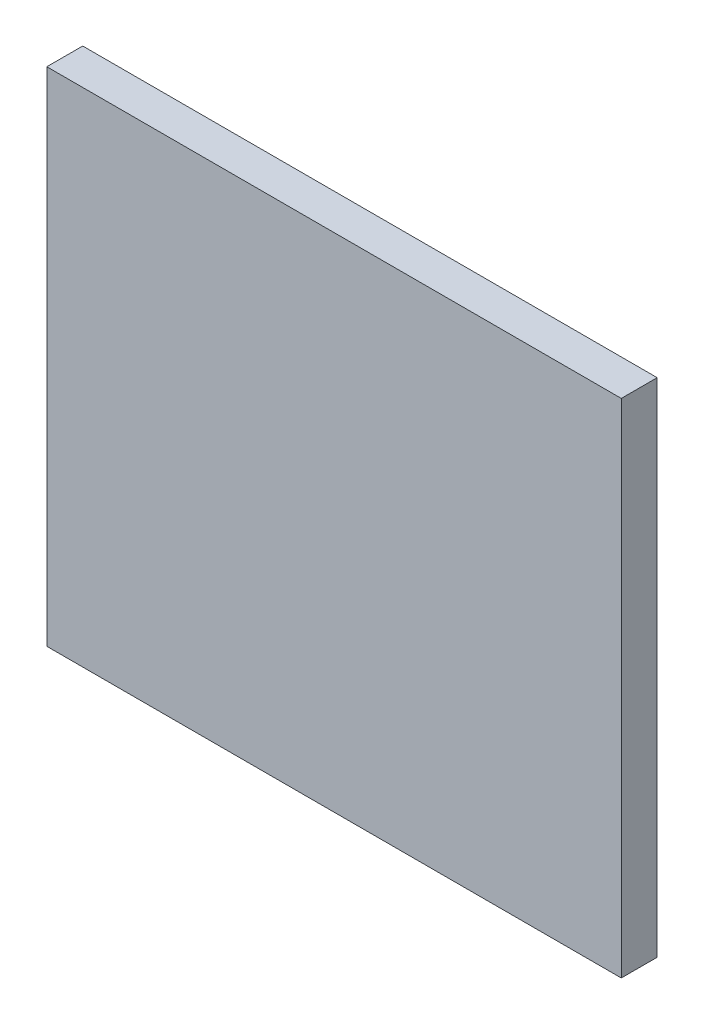
from build123d import *

# Parameters (mm, degrees)
SKETCH1_W           = 101.6
SKETCH1_H           = 88.77554
BOSS_EXTRUDE1_DEPTH = 6.35


with BuildPart() as part:
    # Sketch1 → Boss-Extrude1 (new body)
    with BuildSketch(Plane.XY):
        Rectangle(SKETCH1_W, SKETCH1_H)
    extrude(amount=BOSS_EXTRUDE1_DEPTH)


solid = part.part
